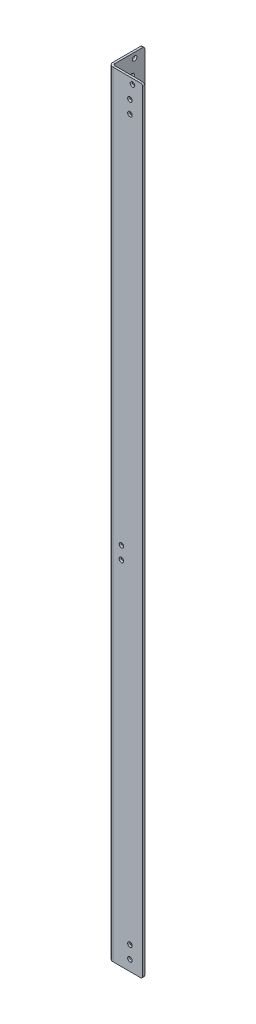
from build123d import *

# Parameters (mm, degrees)
BASE_FLANGE1_DEPTH = 1159.383
SKETCH2_R          = 3.429
CUT_EXTRUDE1_DEPTH = 3.175
SKETCH3_R          = 3.429
CUT_EXTRUDE2_DEPTH = 3.175
FILLET1_R          = 3.175


# Sheet-metal steps are written as plain solids
with BuildPart() as part:
    # Sketch1 → Base-Flange1 (new body)
    with BuildSketch(Plane(origin=(0, 0, 0), x_dir=(1, 0, 0), z_dir=(0, 1, 0))):
        with BuildLine():
            Line((0, 50.8), (0, 6.35))
            ThreePointArc((0, 6.35), (1.859871939, 1.859871939), (6.35, 0))
            Line((6.35, 0), (50.8, 0))
            Line((50.8, 0), (50.8, 3.175))
            Line((50.8, 3.175), (6.35, 3.175))
            ThreePointArc((6.35, 3.175), (4.10493597, 4.10493597), (3.175, 6.35))
            Line((3.175, 6.35), (3.175, 50.8))
            Line((3.175, 50.8), (0, 50.8))
        make_face()
    extrude(amount=BASE_FLANGE1_DEPTH)

    # Sketch2 → Cut-Extrude1 (cut)
    with BuildSketch(Plane.XY):
        with Locations((31.75, 34.925)):
            Circle(SKETCH2_R)
        with Locations((31.75, 15.875)):
            Circle(SKETCH2_R)
        with Locations((19.05, 546.1)):
            Circle(SKETCH2_R)
        with Locations((19.05, 527.05)):
            Circle(SKETCH2_R)
        with Locations((31.75, 1130.173)):
            Circle(SKETCH2_R)
        with Locations((31.75, 1111.123)):
            Circle(SKETCH2_R)
        with Locations((35.56, 1151.4455)):
            Circle(SKETCH2_R)
    extrude(amount=-CUT_EXTRUDE1_DEPTH, mode=Mode.SUBTRACT)

    # Sketch3 → Cut-Extrude2 (cut)
    with BuildSketch(Plane.ZY):
        with Locations((-35.56, 1151.4455)):
            Circle(SKETCH3_R)
        with Locations((-31.75, 34.925)):
            Circle(SKETCH3_R)
        with Locations((-31.75, 15.875)):
            Circle(SKETCH3_R)
        with Locations((-19.05, 546.1)):
            Circle(SKETCH3_R)
        with Locations((-19.05, 527.05)):
            Circle(SKETCH3_R)
        with Locations((-31.75, 1130.173)):
            Circle(SKETCH3_R)
        with Locations((-31.75, 1111.123)):
            Circle(SKETCH3_R)
    extrude(amount=-CUT_EXTRUDE2_DEPTH, mode=Mode.SUBTRACT)

    # Fillet1
    fillet1_edges = [part.edges().sort_by_distance(p)[0] for p in [
        (1.5875, 1159.383, -50.8),
        (1.5875, 0, -50.8),
        (50.8, 1159.383, -1.5875),
        (50.8, 0, -1.5875),
    ]]
    fillet(fillet1_edges, radius=FILLET1_R)


solid = part.part
